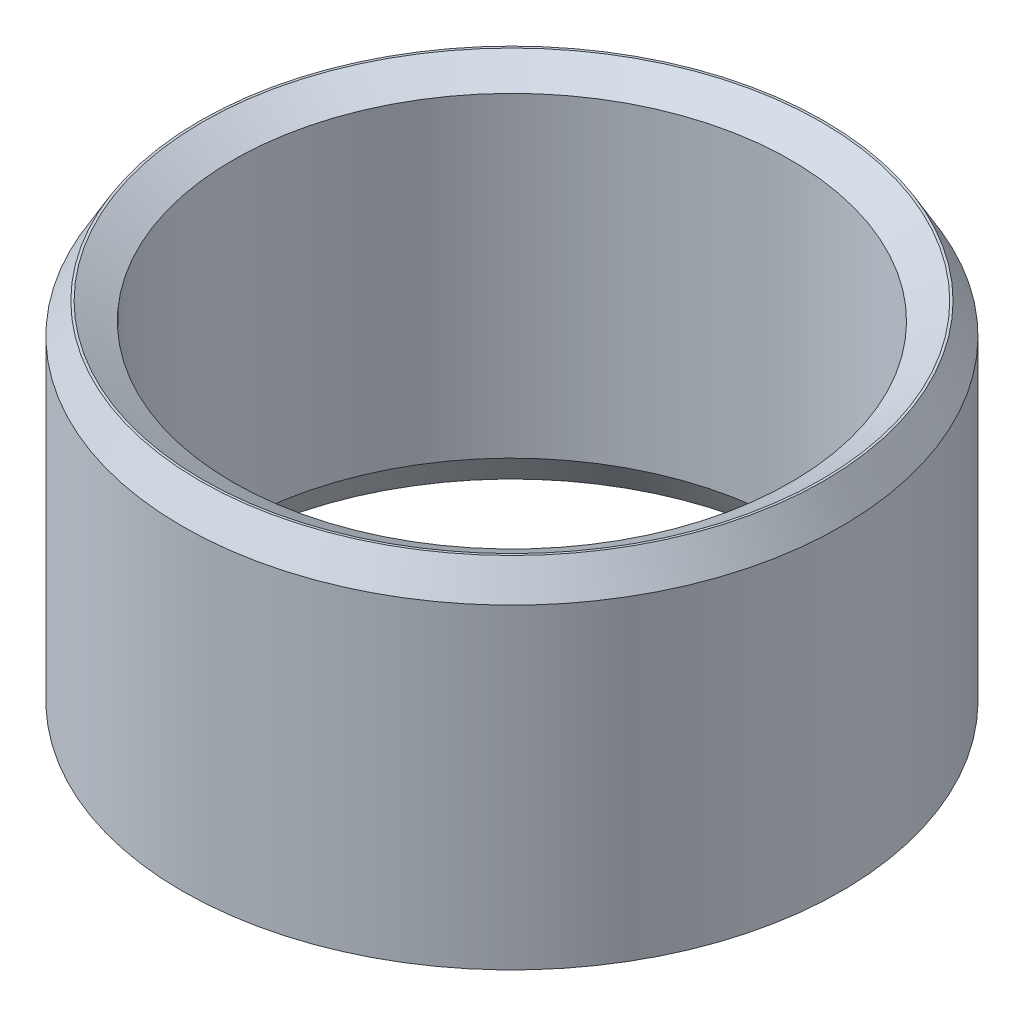
from build123d import *
from OCP.BRepFilletAPI import BRepFilletAPI_MakeChamfer

# Parameters (mm, degrees)
SKETCH1_R           = 40
BOSS_EXTRUDE1_DEPTH = 44.192319107
SKETCH2_R           = 33.8658472
CUT_EXTRUDE1_DEPTH  = 72.784128246
CHAMFER1_SIZE       = 3.709555218
CHAMFER1_SIZE2      = 2.141712704


with BuildPart() as part:
    # Sketch1 → Boss-Extrude1 (new body)
    with BuildSketch(Plane(origin=(0, 0, 0), x_dir=(1, 0, 0), z_dir=(0, 1, 0))):
        Circle(SKETCH1_R)
    extrude(amount=BOSS_EXTRUDE1_DEPTH)

    # Sketch2 → Cut-Extrude1 (cut, through all)
    with BuildSketch(Plane(origin=(0, 0, 0), x_dir=(1, 0, 0), z_dir=(0, 1, 0))):
        Circle(SKETCH2_R)
    extrude(amount=CUT_EXTRUDE1_DEPTH, mode=Mode.SUBTRACT)

    # Chamfer1: one chamfer whose edges measure the first distance from different faces: ONE call of the kernel's chamfer builder (chamfer() names one face for all edges)
    chamfer1_edges_1 = [part.edges().sort_by_distance(p)[0] for p in [
        (-33.8658472, 44.192319107, 0),
    ]]
    chamfer1_side_1 = [part.faces().sort_by_distance(p)[0] for p in [
        (-38.86862915, 44.192319107, 0),
    ]]
    chamfer1_edges_2 = [part.edges().sort_by_distance(p)[0] for p in [
        (-33.8658472, 0, 0),
    ]]
    chamfer1_side_2 = [part.faces().sort_by_distance(p)[0] for p in [
        (-33.8658472, 22.096159554, 0),
    ]]
    chamfer1_edges_3 = [part.edges().sort_by_distance(p)[0] for p in [
        (-40, 0, 0),
    ]]
    chamfer1_side_3 = [part.faces().sort_by_distance(p)[0] for p in [
        (-38.86862915, 0, 0),
    ]]
    chamfer1_edges_4 = [part.edges().sort_by_distance(p)[0] for p in [
        (-40, 44.192319107, 0),
    ]]
    chamfer1_side_4 = [part.faces().sort_by_distance(p)[0] for p in [
        (-40, 22.096159554, 0),
    ]]
    chamfer1 = BRepFilletAPI_MakeChamfer(part.part.solid().wrapped)
    for e in chamfer1_edges_1:
        chamfer1.Add(CHAMFER1_SIZE, CHAMFER1_SIZE2, e.wrapped, chamfer1_side_1[0].wrapped)  # the first distance lies on this face
    for e in chamfer1_edges_2:
        chamfer1.Add(CHAMFER1_SIZE, CHAMFER1_SIZE2, e.wrapped, chamfer1_side_2[0].wrapped)  # the first distance lies on this face
    for e in chamfer1_edges_3:
        chamfer1.Add(CHAMFER1_SIZE, CHAMFER1_SIZE2, e.wrapped, chamfer1_side_3[0].wrapped)  # the first distance lies on this face
    for e in chamfer1_edges_4:
        chamfer1.Add(CHAMFER1_SIZE, CHAMFER1_SIZE2, e.wrapped, chamfer1_side_4[0].wrapped)  # the first distance lies on this face
    add(Compound.cast(chamfer1.Shape()), mode=Mode.REPLACE)


solid = part.part
